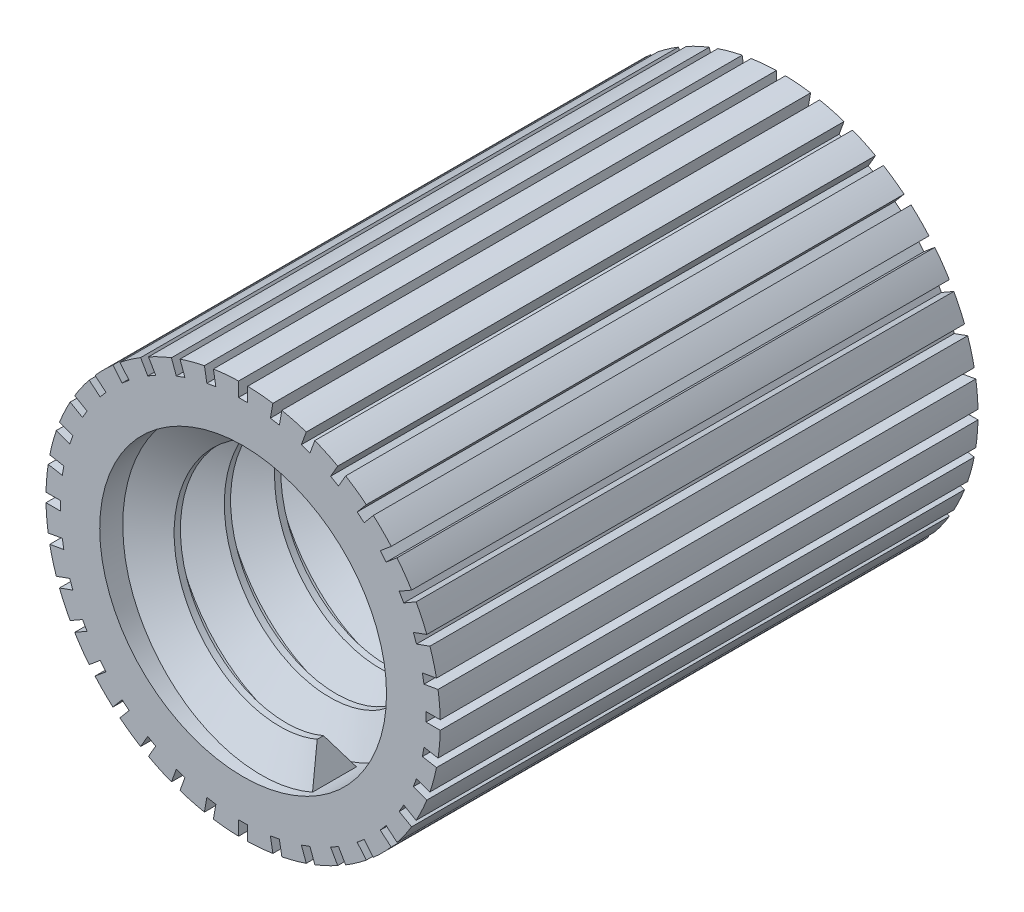
from build123d import *

# Parameters (mm, degrees)
SKETCH2_R               = 2.75
EXTRUDE2_DEPTH          = 7.5
SKETCH3_W               = 0.127
SKETCH3_H               = 0.2
CUT_EXTRUDE_THIN1_DEPTH = 7.5
CIRPATTERN1_COUNT       = 36
SKETCH7_R               = 2
CUT_EXTRUDE3_DEPTH      = 9.44789533
SWEEP1_PITCH            = 0.7
SKETCH11_R              = 2.75
CUT_EXTRUDE5_DEPTH      = 9.447895483


with BuildPart() as part:
    # Sketch2 → Extrude2 (new body)
    with BuildSketch(Plane(origin=(0, 0, 0), x_dir=(-1, 0, 0), z_dir=(0, 0, -1))):
        Circle(SKETCH2_R)
    extrude(amount=EXTRUDE2_DEPTH)

    # Sketch3 → Cut-Extrude-Thin1 (cut)
    with BuildSketch(Plane(origin=(0, 0, -7.5), x_dir=(-1, 0, 0), z_dir=(0, 0, -1))):
        with Locations((0, 2.65)):
            Rectangle(SKETCH3_W, SKETCH3_H)
    cut_extrude_thin1 = extrude(amount=-CUT_EXTRUDE_THIN1_DEPTH, mode=Mode.SUBTRACT)

    # CirPattern1: Cut-Extrude-Thin1 ×36 about axis
    cirpattern1_axis = Axis((0, 0, 0), (0, 0, 1))
    for i in range(1, CIRPATTERN1_COUNT):
        add(cut_extrude_thin1.rotate(cirpattern1_axis, i * 360 / CIRPATTERN1_COUNT), mode=Mode.SUBTRACT)

    # Sketch7 → Cut-Extrude3 (cut, through all)
    with BuildSketch(Plane.XY):
        Circle(SKETCH7_R)
    extrude(amount=-CUT_EXTRUDE3_DEPTH, mode=Mode.SUBTRACT)

    # Sweep1: the profile of Sketch9 profile screwed along a right-hand helix of 10.571429 turns, 6 arcs to a turn; built about Z, then put on its axis
    sweep1_z = Axis((0, 0, 0), (0, 0, 1))
    sweep1_corners = [(2.0003, 0, -0.612673205), (1.545336663, 0, -0.35), (1.545336663, 0, -0.2625), (2.0003, 0, 0.000173205)]
    with BuildLine(mode=Mode.PRIVATE) as sweep1_profile:
        Line(sweep1_corners[0], sweep1_corners[1])
        Line(sweep1_corners[1], sweep1_corners[2])
        Line(sweep1_corners[2], sweep1_corners[3])
        Line(sweep1_corners[3], sweep1_corners[0])
    sweep1_cap = Face(sweep1_profile.wire())
    sweep1_turn_angles = [0, 30, 60, 90, 120, 150, 180, 210, 240, 270, 300, 330, 360]
    sweep1_turn_weights = [1, 0.8660254037844387, 1, 0.8660254037844387, 1, 0.8660254037844387, 1, 0.8660254037844387, 1, 0.8660254037844387, 1, 0.8660254037844387, 1]
    sweep1_turn_rails = [Edge.make_bspline([Vector(p[0], p[1], 0).rotate(sweep1_z, sweep1_turn_angles[k]) / sweep1_turn_weights[k] + Vector(0, 0, p[2] + SWEEP1_PITCH * sweep1_turn_angles[k] / 360) for k in range(13)], [0, 0, 0, 1, 1, 2, 2, 3, 3, 4, 4, 5, 5, 6, 6, 6], 2, sweep1_turn_weights) for p in sweep1_corners]
    sweep1_turn_sides = [Face.make_surface_from_curves(sweep1_turn_rails[p[0]], sweep1_turn_rails[p[1]]) for p in [(0, 1), (1, 2), (2, 3), (3, 0)]]
    sweep1_last_angles = [3600, 3630, 3660, 3690, 3720, 3750, 3780, 3792.857142857, 3805.714285714]
    sweep1_last_weights = [1, 0.8660254037844387, 1, 0.8660254037844387, 1, 0.8660254037844387, 1, 0.9749279121818014, 1]
    sweep1_last_rails = [Edge.make_bspline([Vector(p[0], p[1], 0).rotate(sweep1_z, sweep1_last_angles[k]) / sweep1_last_weights[k] + Vector(0, 0, p[2] + SWEEP1_PITCH * sweep1_last_angles[k] / 360) for k in range(9)], [0, 0, 0, 1, 1, 2, 2, 3, 3, 4, 4, 4], 2, sweep1_last_weights) for p in sweep1_corners]
    sweep1_last_sides = [Face.make_surface_from_curves(sweep1_last_rails[p[0]], sweep1_last_rails[p[1]]) for p in [(0, 1), (1, 2), (2, 3), (3, 0)]]
    sweep1 = Plane(origin=(0, 0, -7.5), x_dir=(0, 1, 0), z_dir=(0, 0, 1)) * Solid(Shell([*[p.moved(Location((0, 0, SWEEP1_PITCH * i))) for i in range(10) for p in sweep1_turn_sides], *sweep1_last_sides, sweep1_cap, sweep1_cap.rotate(sweep1_z, 3805.714285714).moved(Location((0, 0, SWEEP1_PITCH * 3805.714285714 / 360)))]))
    add(sweep1)

    # Sketch11 → Cut-Extrude5 (cut, through all)
    with BuildSketch(Plane(origin=(0, 0, -7.5), x_dir=(-1, 0, 0), z_dir=(0, 0, -1))):
        Circle(SKETCH11_R)
    extrude(amount=CUT_EXTRUDE5_DEPTH, mode=Mode.SUBTRACT)

    # Cut-Extrude7 cone 1 section (through the dimple's axis) → Cut-Extrude7 (revolve, cut)
    with BuildSketch(Plane(origin=(0, 0, -7.5), x_dir=(0, 1, 0), z_dir=(1, 0, 0))):
        Polygon((0, 0), (2.0508, 0), (0, 2.0508), align=None)
    revolve(axis=Axis((0, 0, -7.5), (0, 0, 1)), mode=Mode.SUBTRACT)


solid = part.part
